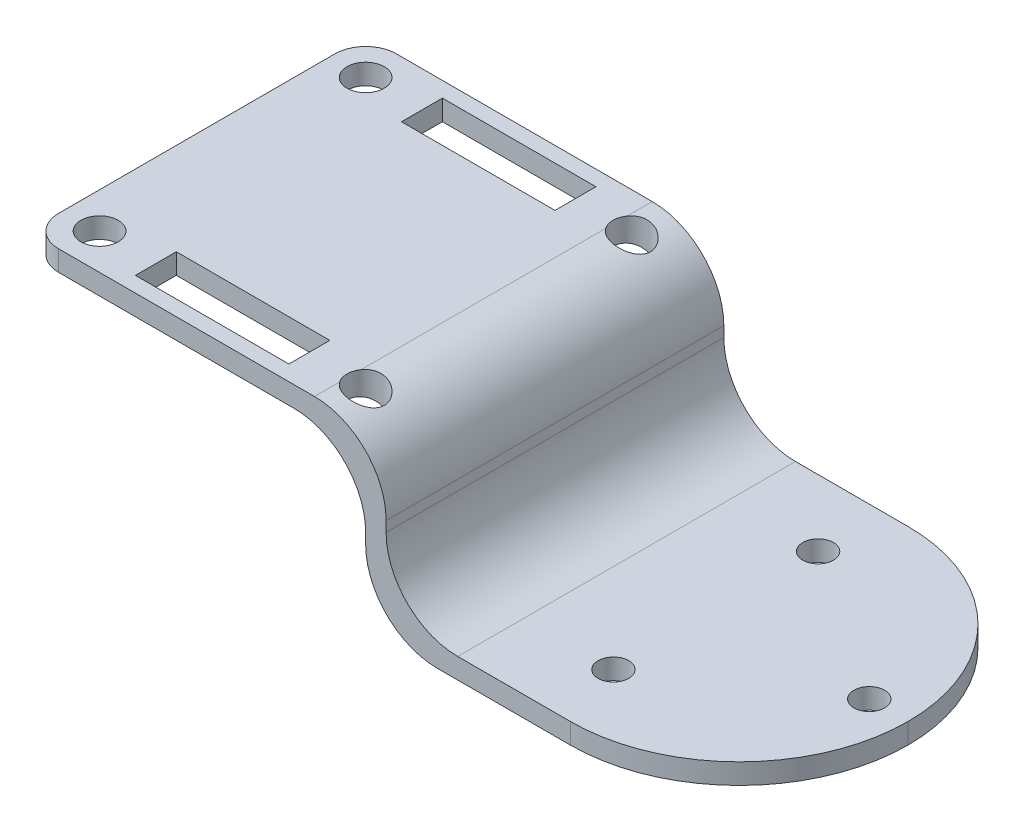
from build123d import *

# Parameters (mm, degrees)
SKETCH1_W                = 33
SKETCH1_H                = 33
SKETCH1_R                = 1.824627508
SKETCH1_W_2              = 15
SKETCH1_H_2              = 4
BOSS_EXTRUDE1_DEPTH      = 2
SKETCH2_W                = 36.501337607
SKETCH2_H                = 33
SKETCH2_R                = 1.5
BOSS_EXTRUDE2_DEPTH      = 2
BOSS_EXTRUDE3_DEPTH      = 2
BOSS_EXTRUDE3_DEPTH_BACK = 15
SKETCH1_3_W              = 2
SKETCH1_3_H              = 33
FILLET1_R                = 7
FILLET2_R                = 16.5
FILLET3_R                = 3


# Some blends are built 0.0001 mm under size
with BuildPart() as part:
    # Sketch1 → Boss-Extrude1 (new body)
    with BuildSketch(Plane(origin=(0, 0, 0), x_dir=(1, 0, 0), z_dir=(0, 1, 0))):
        Rectangle(SKETCH1_W, SKETCH1_H)
        with Locations(Location((-13, -13, 0), (0, 0, 270))):
            Circle(SKETCH1_R, mode=Mode.SUBTRACT)
        with Locations(Location((13, -13, 0), (0, 0, 270))):
            Circle(SKETCH1_R, mode=Mode.SUBTRACT)
        with Locations(Location((13, 13, 0), (0, 0, 270))):
            Circle(SKETCH1_R, mode=Mode.SUBTRACT)
        with Locations(Location((-13, 13, 0), (0, 0, 270))):
            Circle(SKETCH1_R, mode=Mode.SUBTRACT)
        with Locations((0, 13)):
            Rectangle(SKETCH1_W_2, SKETCH1_H_2, mode=Mode.SUBTRACT)
        with Locations((0, -13)):
            Rectangle(SKETCH1_W_2, SKETCH1_H_2, mode=Mode.SUBTRACT)
    extrude(amount=BOSS_EXTRUDE1_DEPTH)



with BuildPart() as body_2:
    # Sketch2 → Boss-Extrude2 (new body)
    with BuildSketch(Plane(origin=(0, -15, 0), x_dir=(1, 0, 0), z_dir=(0, 1, 0))):
        with Locations((34.750668804, 0)):
            Rectangle(SKETCH2_W, SKETCH2_H)
        with Locations(Location((34.210179074, 10, 0), (0, 0, 270))):
            Circle(SKETCH2_R, mode=Mode.SUBTRACT)
        with Locations(Location((49.210179074, 0, 0), (0, 0, 270))):
            Circle(SKETCH2_R, mode=Mode.SUBTRACT)
        with Locations(Location((34.210179074, -10, 0), (0, 0, 270))):
            Circle(SKETCH2_R, mode=Mode.SUBTRACT)
    extrude(amount=BOSS_EXTRUDE2_DEPTH)


with BuildPart() as part_1:
    add(part.part)

    add(body_2.part)  # Boss-Extrude3 merges body 2
    # Sketch1<3> → Boss-Extrude3 (add, two sides: drawn at the far end of the back side and taken through both)
    with BuildSketch(Plane(origin=(0, 0, 0), x_dir=(1, 0, 0), z_dir=(0, 1, 0)).offset(-BOSS_EXTRUDE3_DEPTH_BACK)):
        with Locations((17.5, 0)):
            Rectangle(SKETCH1_3_W, SKETCH1_3_H)
    extrude(amount=BOSS_EXTRUDE3_DEPTH + BOSS_EXTRUDE3_DEPTH_BACK)

    # Fillet1
    # the kernel refuses this fillet: 7 mm, written as the material it adds along each edge
    with BuildSketch(Plane(origin=(16.5, 0, -16.5), x_dir=(0, -1, 0), z_dir=(0, 0, 1))) as fillet1_piece_1_section:
        with BuildLine():
            CenterArc((FILLET1_R, -FILLET1_R), FILLET1_R, 90, 90)
            Line((0, -FILLET1_R), (0, 0))
            Line((0, 0), (FILLET1_R, 0))
        make_face()
    fillet1_piece_1 = extrude(amount=33, mode=Mode.PRIVATE)
    fillet1_piece_1 = fillet1_piece_1 - Plane(origin=(13, -1.648536781, -13), x_dir=(0, 0, 1), z_dir=(0, -1, 0)) * Cylinder(1.824627508, 94, mode=Mode.PRIVATE)
    fillet1_piece_1 = fillet1_piece_1 - Plane(origin=(13, -1.648536781, 13), x_dir=(0, 0, 1), z_dir=(0, -1, 0)) * Cylinder(1.824627508, 94, mode=Mode.PRIVATE)
    add(fillet1_piece_1)
    with BuildSketch(Plane(origin=(18.5, -13, 16.5), x_dir=(0, 1, 0), z_dir=(0, 0, -1))) as fillet1_piece_2:
        with BuildLine():
            CenterArc((FILLET1_R, FILLET1_R), FILLET1_R, 180, 90)
            Line((0, FILLET1_R), (0, 0))
            Line((0, 0), (FILLET1_R, 0))
        make_face()
    extrude(amount=33)
    # the kernel refuses this fillet: 7 mm, written as the material it takes off along each edge
    with BuildSketch(Plane(origin=(18.5, 2, 34), x_dir=(-1, 0, 0), z_dir=(0, 0, -1)), Plane(origin=(16.5, -15, 34), x_dir=(1, 0, 0), z_dir=(0, 0, -1))) as fillet1_2_piece_1:
        with BuildLine():
            CenterArc((FILLET1_R, -FILLET1_R), FILLET1_R, 90, 90)
            Line((0, -FILLET1_R), (0, 0))
            Line((0, 0), (FILLET1_R, 0))
        make_face()
    extrude(amount=68, mode=Mode.SUBTRACT)

    # Fillet2
    fillet2_edges = [part_1.edges().sort_by_distance(p)[0] for p in [
        (53.001337607, -14, -16.5),
        (53.001337607, -14, 16.5),
    ]]
    fillet(fillet2_edges, radius=FILLET2_R - 0.0001)  # a hair under: the kernel refuses the full size

    # Fillet3
    fillet3_edges = [part_1.edges().sort_by_distance(p)[0] for p in [
        (-16.5, 1, 16.5),
        (-16.5, 1, -16.5),
    ]]
    fillet(fillet3_edges, radius=FILLET3_R)


solid = part_1.part
